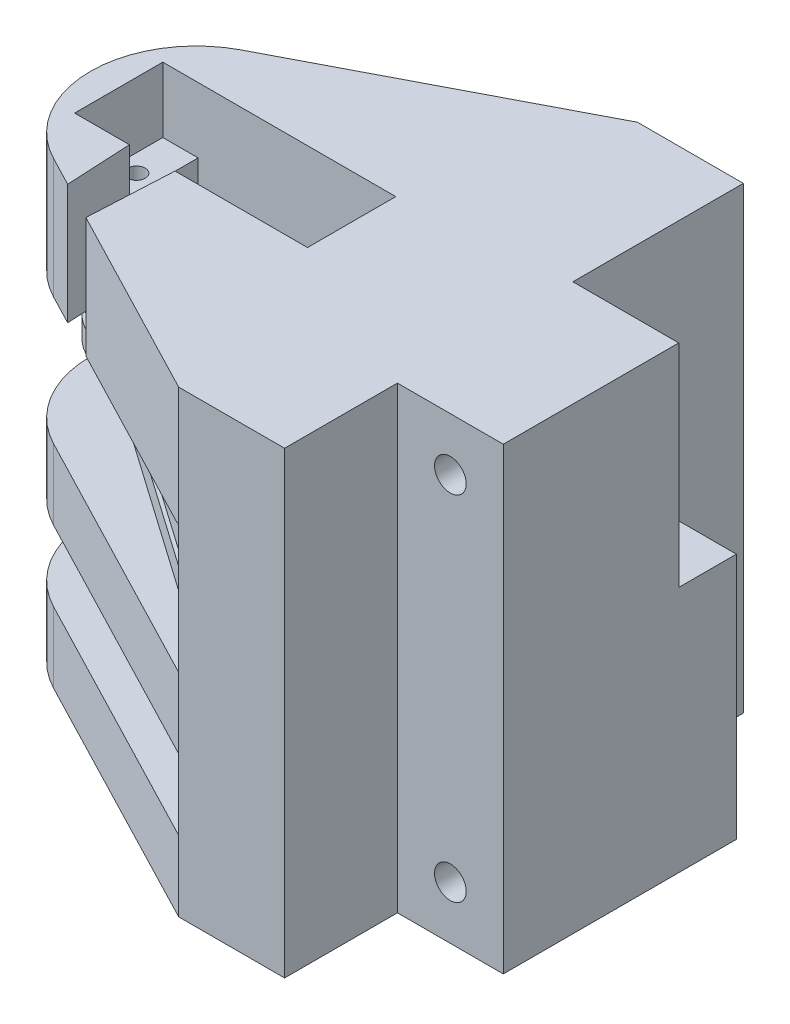
from build123d import *

# Parameters (mm, degrees)
SKETCH1_W           = 75
SKETCH1_H           = 65
BOSS_EXTRUDE1_DEPTH = 65
SKETCH3_W           = 15
SKETCH3_H           = 15.99
CUT_EXTRUDE1_DEPTH  = 65.72
SKETCH4_R           = 2.24505
CUT_EXTRUDE2_DEPTH  = 45.72
SKETCH5_W           = 65
SKETCH5_H           = 10
SKETCH5_H_2         = 2
CUT_EXTRUDE3_DEPTH  = 45
CUT_EXTRUDE4_DEPTH  = 65
SKETCH10_R          = 1
CUT_EXTRUDE6_DEPTH  = 42
CUT_EXTRUDE7_DEPTH  = 20
SKETCH14_W          = 23
SKETCH14_H          = 12.5
CUT_EXTRUDE9_DEPTH  = 13.75
SKETCH16_W          = 5
SKETCH16_H          = 12.5
CUT_EXTRUDE10_DEPTH = 9.25
SKETCH16_4_R        = 1.25
CUT_EXTRUDE11_DEPTH = 12.5
CUT_EXTRUDE12_DEPTH = 21.5
CUT_EXTRUDE13_DEPTH = 8
SKETCH20_R          = 2
BOSS_EXTRUDE2_DEPTH = 0.5
SKETCH21_R          = 2
BOSS_EXTRUDE3_DEPTH = 0.5
SKETCH22_R          = 1
CUT_EXTRUDE14_DEPTH = 30.5
SKETCH23_W          = 15
SKETCH23_H          = 8.162751505
CUT_EXTRUDE15_DEPTH = 30


with BuildPart() as part:
    # Sketch1 → Boss-Extrude1 (new body)
    with BuildSketch(Plane.XY):
        with Locations((37.5, 32.5)):
            Rectangle(SKETCH1_W, SKETCH1_H)
    extrude(amount=BOSS_EXTRUDE1_DEPTH)

    # Sketch3 → Cut-Extrude1 (cut)
    with BuildSketch(Plane.XZ):
        with Locations((67.5, 57.005)):
            Rectangle(SKETCH3_W, SKETCH3_H)
        with Locations((67.5, 7.995)):
            Rectangle(SKETCH3_W, SKETCH3_H)
    extrude(amount=-CUT_EXTRUDE1_DEPTH, mode=Mode.SUBTRACT)

    # Sketch4 → Cut-Extrude2 (cut)
    with BuildSketch(Plane.XY.offset(49.01)):
        with Locations((67.5, 7.5)):
            Circle(SKETCH4_R)
        with Locations((67.5, 57.5)):
            Circle(SKETCH4_R)
    extrude(amount=-CUT_EXTRUDE2_DEPTH, mode=Mode.SUBTRACT)

    # Sketch5 → Cut-Extrude3 (cut)
    with BuildSketch(Plane.ZY):
        with Locations((32.5, 15)):
            Rectangle(SKETCH5_W, SKETCH5_H)
        with Locations((32.5, 35)):
            Rectangle(SKETCH5_W, SKETCH5_H)
        with Locations((32.5, 44)):
            Rectangle(SKETCH5_W, SKETCH5_H_2)
    extrude(amount=-CUT_EXTRUDE3_DEPTH, mode=Mode.SUBTRACT)

    # Sketch6 → Cut-Extrude4 (cut)
    with BuildSketch(Plane.XZ):
        with BuildLine():
            Line((0, 0), (45, 0))
            Line((45, 0), (8.081639583, 19.19074423))
            ThreePointArc((8.081639583, 19.19074423), (2.178623197, 24.714610037), (0, 32.5))
            Line((0, 32.5), (0, 0))
        make_face()
        with BuildLine():
            Line((0, 65), (0, 32.5))
            ThreePointArc((0, 32.5), (2.178623197, 40.285389963), (8.081639583, 45.80925577))
            Line((8.081639583, 45.80925577), (45, 65))
            Line((45, 65), (0, 65))
        make_face()
    extrude(amount=-CUT_EXTRUDE4_DEPTH, mode=Mode.SUBTRACT)

    # Sketch10 → Cut-Extrude6 (cut)
    with BuildSketch(Plane.XZ):
        with Locations((15, 32.5)):
            Circle(SKETCH10_R)
    extrude(amount=-CUT_EXTRUDE6_DEPTH, mode=Mode.SUBTRACT)

    # Sketch12 → Cut-Extrude7 (cut)
    with BuildSketch(Plane(origin=(0, 65, 0), x_dir=(1, 0, 0), z_dir=(0, 1, 0))):
        with BuildLine():
            ThreePointArc((20.252618395, -29.6), (9, -32.5), (20.252618395, -35.4))
            Line((20.252618395, -35.4), (21.452618395, -35.4))
            ThreePointArc((21.452618395, -35.4), (24.352618395, -32.5), (21.452618395, -29.6))
            Line((21.452618395, -29.6), (20.252618395, -29.6))
        make_face()
    extrude(amount=-CUT_EXTRUDE7_DEPTH, mode=Mode.SUBTRACT)

    # Sketch14 → Cut-Extrude9 (cut)
    with BuildSketch(Plane(origin=(0, 65, 0), x_dir=(1, 0, 0), z_dir=(0, 1, 0))):
        with Locations((20.5, -32.5)):
            Rectangle(SKETCH14_W, SKETCH14_H)
    extrude(amount=-CUT_EXTRUDE9_DEPTH, mode=Mode.SUBTRACT)

    # Sketch16 → Cut-Extrude10 (cut)
    with BuildSketch(Plane(origin=(0, 65, 0), x_dir=(1, 0, 0), z_dir=(0, 1, 0))):
        with Locations((6.5, -32.5)):
            Rectangle(SKETCH16_W, SKETCH16_H)
        with Locations((34.5, -32.5)):
            Rectangle(SKETCH16_W, SKETCH16_H)
    extrude(amount=-CUT_EXTRUDE10_DEPTH, mode=Mode.SUBTRACT)

    # Sketch16<4> → Cut-Extrude11 (cut)
    with BuildSketch(Plane(origin=(0, 65, 0), x_dir=(1, 0, 0), z_dir=(0, 1, 0))):
        with Locations((6.5, -32.5)):
            Circle(SKETCH16_4_R)
        with Locations((34.5, -32.5)):
            Circle(SKETCH16_4_R)
    extrude(amount=-CUT_EXTRUDE11_DEPTH, mode=Mode.SUBTRACT)

    # Sketch18 → Cut-Extrude12 (cut)
    with BuildSketch(Plane(origin=(0, 65, 0), x_dir=(1, 0, 0), z_dir=(0, 1, 0))):
        with BuildLine():
            Line((11.45, -32.5), (12.243292666, -47.972548478))
            Line((12.243292666, -47.972548478), (17.613581303, -50.764108951))
            Line((17.613581303, -50.764108951), (18.55, -32.5))
            ThreePointArc((18.55, -32.5), (15, -28.95), (11.45, -32.5))
        make_face()
    extrude(amount=-CUT_EXTRUDE12_DEPTH, mode=Mode.SUBTRACT)

    # Sketch19 → Cut-Extrude13 (cut)
    with BuildSketch(Plane.XZ.offset(-40)):
        with BuildLine():
            Line((15, 44), (45, 65))
            Line((45, 65), (8.081639583, 45.80925577))
            ThreePointArc((8.081639583, 45.80925577), (0, 32.5), (8.081639583, 19.19074423))
            Line((8.081639583, 19.19074423), (45, 0))
            Line((45, 0), (15, 21))
            ThreePointArc((15, 21), (3.5, 32.5), (15, 44))
        make_face()
    extrude(amount=-CUT_EXTRUDE13_DEPTH, mode=Mode.SUBTRACT)

    # Sketch20 → Boss-Extrude2 (add)
    with BuildSketch(Plane(origin=(0, 30, 0), x_dir=(1, 0, 0), z_dir=(0, 1, 0))):
        with Locations((15, -32.5)):
            Circle(SKETCH20_R)
    extrude(amount=BOSS_EXTRUDE2_DEPTH)

    # Sketch21 → Boss-Extrude3 (add)
    with BuildSketch(Plane(origin=(0, 10, 0), x_dir=(1, 0, 0), z_dir=(0, 1, 0))):
        with Locations((15, -32.5)):
            Circle(SKETCH21_R)
    extrude(amount=BOSS_EXTRUDE3_DEPTH)

    # Sketch22 → Cut-Extrude14 (cut)
    with BuildSketch(Plane.XZ):
        with Locations((15, 32.5)):
            Circle(SKETCH22_R)
    extrude(amount=-CUT_EXTRUDE14_DEPTH, mode=Mode.SUBTRACT)

    # Sketch23 → Cut-Extrude15 (cut)
    with BuildSketch(Plane(origin=(0, 65, 0), x_dir=(1, 0, 0), z_dir=(0, 1, 0))):
        with Locations((67.5, -20.071375752)):
            Rectangle(SKETCH23_W, SKETCH23_H)
    extrude(amount=-CUT_EXTRUDE15_DEPTH, mode=Mode.SUBTRACT)


solid = part.part
